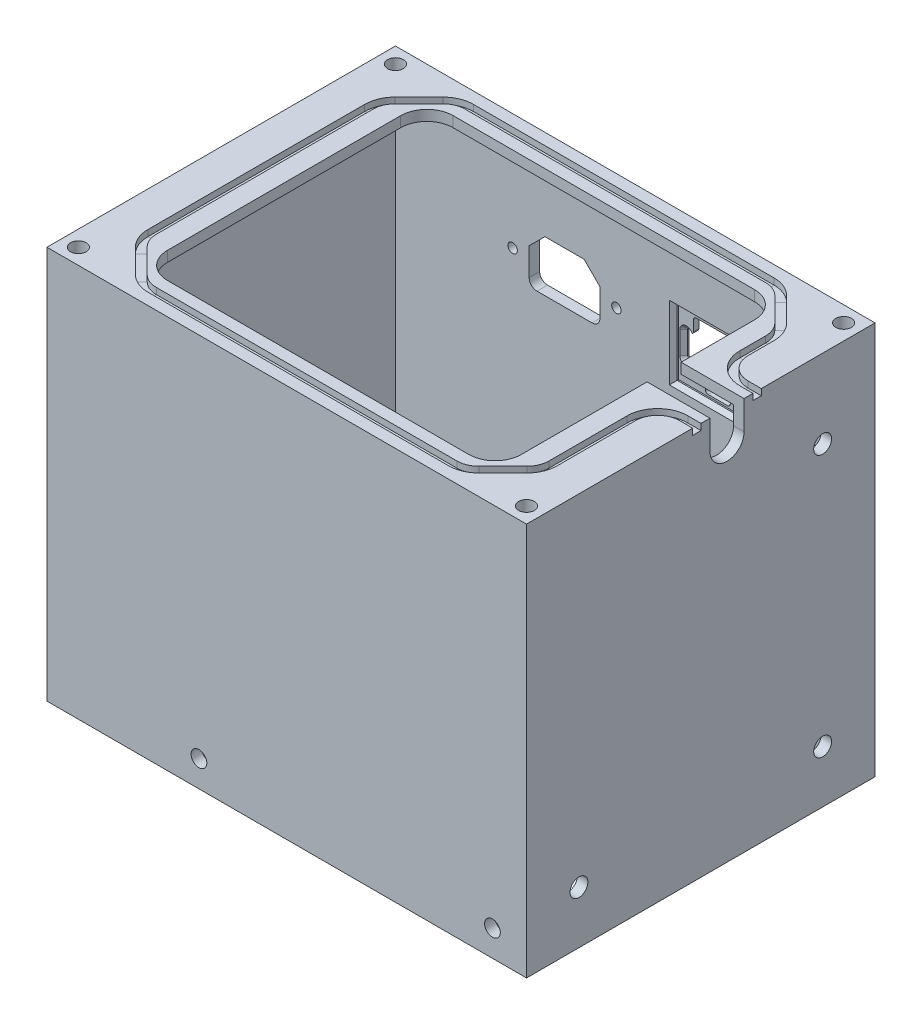
from build123d import *

# Parameters (mm, degrees)
SKETCH1_W           = 183
SKETCH1_H           = 133
SKETCH1_W_2         = 175
SKETCH1_H_2         = 125
BOSS_EXTRUDE1_DEPTH = 150
CUT_EXTRUDE1_REACH  = 219.975
SKETCH8_R           = 3
SKETCH9_R           = 3
CUT_EXTRUDE2_DEPTH  = 218.975342642
SKETCH11_R          = 1.8
CUT_EXTRUDE3_DEPTH  = 16.85
SKETCH12_W          = 175
SKETCH12_H          = 125
SKETCH12_W_2        = 135
SKETCH12_H_2        = 109
BOSS_EXTRUDE2_DEPTH = 4
BOSS_EXTRUDE3_DEPTH = 12
SKETCH15_R          = 3
CUT_EXTRUDE5_DEPTH  = 10
FILLET1_R           = 10
CUT_EXTRUDE6_REACH  = 247.787
SKETCH24_W          = 3.175
SKETCH24_H          = 2.38125
CUT_EXTRUDE7_REACH  = 247.787
SKETCH23_R          = 3.41
CUT_EXTRUDE8_REACH  = 222.366
SKETCH25_R          = 6.75
SKETCH25_R_2        = 3.41
SKETCH26_R          = 10
SKETCH26_R_2        = 6
CUT_EXTRUDE9_DEPTH  = 2
CHAMFER1_SIZE       = 2
CUT_EXTRUDE10_REACH = 222.366
SKETCH28_W          = 30
SKETCH28_H          = 25
CUT_EXTRUDE11_DEPTH = 2


with BuildPart() as part:
    # Sketch1 → Boss-Extrude1 (new body)
    with BuildSketch(Plane(origin=(0, 0, 0), x_dir=(1, 0, 0), z_dir=(0, 1, 0))):
        Rectangle(SKETCH1_W, SKETCH1_H)
        Rectangle(SKETCH1_W_2, SKETCH1_H_2, mode=Mode.SUBTRACT)
    extrude(amount=BOSS_EXTRUDE1_DEPTH)

    # Sketch8 → Cut-Extrude1 (cut, up to next)
    with BuildSketch(Plane.XY.offset(-62.5), mode=Mode.PRIVATE) as cut_extrude1_sk1:
        with Locations((-41.5, 10)):
            Circle(SKETCH8_R)
    cut_extrude1_tool1 = extrude(cut_extrude1_sk1.sketch, amount=-CUT_EXTRUDE1_REACH, mode=Mode.PRIVATE) & part.part
    # Sketch8 → Cut-Extrude1 (cut, up to next)
    with BuildSketch(Plane.XY.offset(-62.5), mode=Mode.PRIVATE) as cut_extrude1_sk2:
        with Locations((78.5, 10)):
            Circle(SKETCH8_R)
    cut_extrude1_tool2 = extrude(cut_extrude1_sk2.sketch, amount=-CUT_EXTRUDE1_REACH, mode=Mode.PRIVATE) & part.part
    add(cut_extrude1_tool1.solids().sort_by_distance((-41.5, 10, -62.5))[0], mode=Mode.SUBTRACT)
    add(cut_extrude1_tool2.solids().sort_by_distance((78.5, 10, -62.5))[0], mode=Mode.SUBTRACT)

    # Sketch9 → Cut-Extrude2 (cut, through all)
    with BuildSketch(Plane(origin=(0, 0, 62.5), x_dir=(-1, 0, 0), z_dir=(0, 0, -1))):
        with Locations((33.5, 10)):
            Circle(SKETCH9_R)
        with Locations(Location((-78.5, 10, 0), (0, 0, 180))):
            Circle(SKETCH9_R)
    extrude(amount=-CUT_EXTRUDE2_DEPTH, mode=Mode.SUBTRACT)

    # Sketch11 → Cut-Extrude3 (cut, symmetric)
    with BuildSketch(Plane(origin=(0, 0, -66.5), x_dir=(-1, 0, 0), z_dir=(0, 0, -1))):
        with Locations(Location((42.8, 109.6, 0), (0, 0, 180))):
            Circle(SKETCH11_R)
        with Locations(Location((3.2, 109.6, 0), (0, 0, 180))):
            Circle(SKETCH11_R)
        with BuildLine():
            Line((9.5, 103), (9.5, 113.48959236))
            Line((9.5, 113.48959236), (15.51040764, 119.5))
            Line((15.51040764, 119.5), (30.48959236, 119.5))
            Line((30.48959236, 119.5), (36.5, 113.48959236))
            Line((36.5, 113.48959236), (36.5, 103))
            ThreePointArc((36.5, 103), (35.621320344, 100.878679656), (33.5, 100))
            Line((33.5, 100), (12.5, 100))
            ThreePointArc((12.5, 100), (10.378679656, 100.878679656), (9.5, 103))
        make_face()
    extrude(amount=CUT_EXTRUDE3_DEPTH, both=True, mode=Mode.SUBTRACT)

    # Sketch12 → Boss-Extrude2 (add)
    with BuildSketch(Plane(origin=(0, 150, 0), x_dir=(1, 0, 0), z_dir=(0, 1, 0))):
        Rectangle(SKETCH12_W, SKETCH12_H)
        Rectangle(SKETCH12_W_2, SKETCH12_H_2, mode=Mode.SUBTRACT)
    extrude(amount=-BOSS_EXTRUDE2_DEPTH)

    # Sketch13 → Boss-Extrude3 (add)
    with BuildSketch(Plane(origin=(0, 150, 0), x_dir=(1, 0, 0), z_dir=(0, 1, 0))):
        with BuildLine():
            Line((76.5, -66.5), (91.5, -66.5))
            Line((91.5, -66.5), (91.5, -51.5))
            ThreePointArc((91.5, -51.5), (80.893398282, -55.893398282), (76.5, -66.5))
        make_face()
        with BuildLine():
            Line((91.5, 66.5), (91.5, 51.5))
            ThreePointArc((91.5, 51.5), (80.893398282, 55.893398282), (76.5, 66.5))
            Line((76.5, 66.5), (91.5, 66.5))
        make_face()
        with BuildLine():
            Line((-76.5, 66.5), (-91.5, 66.5))
            Line((-91.5, 66.5), (-91.5, 51.5))
            ThreePointArc((-91.5, 51.5), (-80.893398282, 55.893398282), (-76.5, 66.5))
        make_face()
        with BuildLine():
            Line((-91.5, -66.5), (-91.5, -51.5))
            ThreePointArc((-91.5, -51.5), (-80.893398282, -55.893398282), (-76.5, -66.5))
            Line((-76.5, -66.5), (-91.5, -66.5))
        make_face()
    extrude(amount=-BOSS_EXTRUDE3_DEPTH)

    # Sketch15 → Cut-Extrude5 (cut)
    with BuildSketch(Plane(origin=(0, 150, 0), x_dir=(1, 0, 0), z_dir=(0, 1, 0))):
        with Locations(Location((-85.5, -60.5, 0), (0, 0, 270))):
            Circle(SKETCH15_R)
        with Locations(Location((-85.5, 60.5, 0), (0, 0, 270))):
            Circle(SKETCH15_R)
        with Locations(Location((85.5, 60.5, 0), (0, 0, 90))):
            Circle(SKETCH15_R)
        with Locations(Location((85.5, -60.5, 0), (0, 0, 90))):
            Circle(SKETCH15_R)
    extrude(amount=-CUT_EXTRUDE5_DEPTH, mode=Mode.SUBTRACT)

    # Fillet1
    fillet1_edges = [part.edges().sort_by_distance(p)[0] for p in [
        (67.5, 148, -54.5),
        (67.5, 148, 54.5),
        (-67.5, 148, 54.5),
        (-67.5, 148, -54.5),
    ]]
    fillet(fillet1_edges, radius=FILLET1_R)

    # Sketch17 → Cut-Extrude6 (cut, up to next)
    with BuildSketch(Plane(origin=(91.5, 0, 0), x_dir=(0, 0, -1), z_dir=(1, 0, 0)), mode=Mode.PRIVATE) as cut_extrude6_sk1:
        with BuildLine():
            Line((16.5, 139), (16.5, 150))
            Line((16.5, 150), (3.5, 150))
            Line((3.5, 150), (3.5, 139))
            ThreePointArc((3.5, 139), (10, 132.5), (16.5, 139))
        make_face()
    cut_extrude6_tool1 = extrude(cut_extrude6_sk1.sketch, amount=-CUT_EXTRUDE6_REACH, mode=Mode.PRIVATE) & part.part
    add(cut_extrude6_tool1.solids().sort_by_distance((91.5, 141.882112, -10))[0], mode=Mode.SUBTRACT)

    # Cut-Sweep1: sweep along a path in Sketch16
    with BuildLine(Plane(origin=(0, 150, 0), x_dir=(1, 0, 0), z_dir=(0, 1, 0))) as cut_sweep1_path:
        Line((91.5, -1.5), (86.5, -1.5))
        ThreePointArc((86.5, -1.5), (79.428932188, -4.428932188), (76.5, -11.5))
        Line((76.5, -11.5), (76.5, -41.357864376))
        ThreePointArc((76.5, -41.357864376), (75.738795325, -45.1846987), (73.571067812, -48.428932188))
        Line((73.571067812, -48.428932188), (64.428932188, -57.571067812))
        ThreePointArc((64.428932188, -57.571067812), (61.1846987, -59.738795325), (57.357864376, -60.5))
        Line((57.357864376, -60.5), (-57.357864376, -60.5))
        ThreePointArc((-57.357864376, -60.5), (-61.1846987, -59.738795325), (-64.428932188, -57.571067812))
        Line((-64.428932188, -57.571067812), (-73.571067812, -48.428932188))
        ThreePointArc((-73.571067812, -48.428932188), (-75.738795325, -45.1846987), (-76.5, -41.357864376))
        Line((-76.5, -41.357864376), (-76.5, 41.357864376))
        ThreePointArc((-76.5, 41.357864376), (-75.738795325, 45.1846987), (-73.571067812, 48.428932188))
        Line((-73.571067812, 48.428932188), (-64.428932188, 57.571067812))
        ThreePointArc((-64.428932188, 57.571067812), (-61.1846987, 59.738795325), (-57.357864376, 60.5))
        Line((-57.357864376, 60.5), (57.357864376, 60.5))
        ThreePointArc((57.357864376, 60.5), (61.1846987, 59.738795325), (64.428932188, 57.571067812))
        Line((64.428932188, 57.571067812), (73.571067812, 48.428932188))
        ThreePointArc((73.571067812, 48.428932188), (75.738795325, 45.1846987), (76.5, 41.357864376))
        Line((76.5, 41.357864376), (76.5, 31.5))
        ThreePointArc((76.5, 31.5), (79.428932188, 24.428932188), (86.5, 21.5))
        Line((86.5, 21.5), (91.5, 21.5))
    # Sketch24 → Cut-Sweep1 (sweep, cut)
    with BuildSketch(Plane(origin=(0, 0, 0), x_dir=(0, 0, -1), z_dir=(1, 0, 0))):
        with Locations((60.5, 148.809375)):
            Rectangle(SKETCH24_W, SKETCH24_H)
    sweep(path=cut_sweep1_path.line, mode=Mode.SUBTRACT)

    # Sketch23 → Cut-Extrude7 (cut, up to next)
    with BuildSketch(Plane(origin=(91.5, 0, 0), x_dir=(0, 0, -1), z_dir=(1, 0, 0)), mode=Mode.PRIVATE) as cut_extrude7_sk1:
        with Locations((-46.5, 20)):
            Circle(SKETCH23_R)
    cut_extrude7_tool1 = extrude(cut_extrude7_sk1.sketch, amount=-CUT_EXTRUDE7_REACH, mode=Mode.PRIVATE) & part.part
    # Sketch23 → Cut-Extrude7 (cut, up to next)
    with BuildSketch(Plane(origin=(91.5, 0, 0), x_dir=(0, 0, -1), z_dir=(1, 0, 0)), mode=Mode.PRIVATE) as cut_extrude7_sk2:
        with Locations((46.5, 20)):
            Circle(SKETCH23_R)
    cut_extrude7_tool2 = extrude(cut_extrude7_sk2.sketch, amount=-CUT_EXTRUDE7_REACH, mode=Mode.PRIVATE) & part.part
    # Sketch23 → Cut-Extrude7 (cut, up to next)
    with BuildSketch(Plane(origin=(91.5, 0, 0), x_dir=(0, 0, -1), z_dir=(1, 0, 0)), mode=Mode.PRIVATE) as cut_extrude7_sk3:
        with Locations((46.5, 120)):
            Circle(SKETCH23_R)
    cut_extrude7_tool3 = extrude(cut_extrude7_sk3.sketch, amount=-CUT_EXTRUDE7_REACH, mode=Mode.PRIVATE) & part.part
    add(cut_extrude7_tool1.solids().sort_by_distance((91.5, 20, 46.5))[0], mode=Mode.SUBTRACT)
    add(cut_extrude7_tool2.solids().sort_by_distance((91.5, 20, -46.5))[0], mode=Mode.SUBTRACT)
    add(cut_extrude7_tool3.solids().sort_by_distance((91.5, 120, -46.5))[0], mode=Mode.SUBTRACT)

    # Sketch25 → Cut-Extrude8 (cut, up to next)
    with BuildSketch(Plane(origin=(0, 0, -66.5), x_dir=(-1, 0, 0), z_dir=(0, 0, -1)), mode=Mode.PRIVATE) as cut_extrude8_sk1:
        with Locations((-73.7, 45)):
            Circle(SKETCH25_R)
    cut_extrude8_tool1 = extrude(cut_extrude8_sk1.sketch, amount=-CUT_EXTRUDE8_REACH, mode=Mode.PRIVATE) & part.part
    # Sketch25 → Cut-Extrude8 (cut, up to next)
    with BuildSketch(Plane(origin=(0, 0, -66.5), x_dir=(-1, 0, 0), z_dir=(0, 0, -1)), mode=Mode.PRIVATE) as cut_extrude8_sk2:
        with Locations((-29.6, 42.2)):
            Circle(SKETCH25_R_2)
    cut_extrude8_tool2 = extrude(cut_extrude8_sk2.sketch, amount=-CUT_EXTRUDE8_REACH, mode=Mode.PRIVATE) & part.part
    # Sketch25 → Cut-Extrude8 (cut, up to next)
    with BuildSketch(Plane(origin=(0, 0, -66.5), x_dir=(-1, 0, 0), z_dir=(0, 0, -1)), mode=Mode.PRIVATE) as cut_extrude8_sk3:
        with Locations((-1.3, 42.2)):
            Circle(SKETCH25_R_2)
    cut_extrude8_tool3 = extrude(cut_extrude8_sk3.sketch, amount=-CUT_EXTRUDE8_REACH, mode=Mode.PRIVATE) & part.part
    add(cut_extrude8_tool1.solids().sort_by_distance((73.7, 45, -66.5))[0], mode=Mode.SUBTRACT)
    add(cut_extrude8_tool2.solids().sort_by_distance((29.6, 42.2, -66.5))[0], mode=Mode.SUBTRACT)
    add(cut_extrude8_tool3.solids().sort_by_distance((1.3, 42.2, -66.5))[0], mode=Mode.SUBTRACT)

    # Sketch26 → Cut-Extrude9 (cut)
    with BuildSketch(Plane(origin=(0, 0, -66.5), x_dir=(-1, 0, 0), z_dir=(0, 0, -1))):
        with Locations((-73.7, 45)):
            Circle(SKETCH26_R)
        with Locations((-29.6, 42.2)):
            Circle(SKETCH26_R_2)
        with Locations((-1.3, 42.2)):
            Circle(SKETCH26_R_2)
    extrude(amount=-CUT_EXTRUDE9_DEPTH, mode=Mode.SUBTRACT)

    # Chamfer1
    chamfer1_edges = [part.edges().sort_by_distance(p)[0] for p in [
        (83.7, 45, -66.5),
        (7.3, 42.2, -66.5),
        (35.6, 42.2, -66.5),
    ]]
    chamfer(chamfer1_edges, length=CHAMFER1_SIZE - 0.0001)  # a hair under: the kernel refuses the full size

    # Sketch27 → Cut-Extrude10 (cut, up to next)
    with BuildSketch(Plane(origin=(0, 0, -66.5), x_dir=(-1, 0, 0), z_dir=(0, 0, -1)), mode=Mode.PRIVATE) as cut_extrude10_sk1:
        with BuildLine():
            Line((-46.5, 104), (-46.5, 112.5))
            ThreePointArc((-46.5, 112.5), (-46.207106781, 113.207106781), (-45.5, 113.5))
            Line((-45.5, 113.5), (-43.75, 113.5))
            ThreePointArc((-43.75, 113.5), (-43.042893219, 113.792893219), (-42.75, 114.5))
            Line((-42.75, 114.5), (-42.75, 118.5))
            ThreePointArc((-42.75, 118.5), (-42.457106781, 119.207106781), (-41.75, 119.5))
            Line((-41.75, 119.5), (-25.25, 119.5))
            ThreePointArc((-25.25, 119.5), (-24.542893219, 119.207106781), (-24.25, 118.5))
            Line((-24.25, 118.5), (-24.25, 114.5))
            ThreePointArc((-24.25, 114.5), (-23.957106781, 113.792893219), (-23.25, 113.5))
            Line((-23.25, 113.5), (-21.5, 113.5))
            ThreePointArc((-21.5, 113.5), (-20.792893219, 113.207106781), (-20.5, 112.5))
            Line((-20.5, 112.5), (-20.5, 104))
            ThreePointArc((-20.5, 104), (-20.792893219, 103.292893219), (-21.5, 103))
            Line((-21.5, 103), (-27.75, 103))
            ThreePointArc((-27.75, 103), (-28.457106781, 102.707106781), (-28.75, 102))
            Line((-28.75, 102), (-28.75, 97.5))
            ThreePointArc((-28.75, 97.5), (-29.042893219, 96.792893219), (-29.75, 96.5))
            Line((-29.75, 96.5), (-37.25, 96.5))
            ThreePointArc((-37.25, 96.5), (-37.957106781, 96.792893219), (-38.25, 97.5))
            Line((-38.25, 97.5), (-38.25, 102))
            ThreePointArc((-38.25, 102), (-38.542893219, 102.707106781), (-39.25, 103))
            Line((-39.25, 103), (-45.5, 103))
            ThreePointArc((-45.5, 103), (-46.207106781, 103.292893219), (-46.5, 104))
        make_face()
    cut_extrude10_tool1 = extrude(cut_extrude10_sk1.sketch, amount=-CUT_EXTRUDE10_REACH, mode=Mode.PRIVATE) & part.part
    add(cut_extrude10_tool1.solids().sort_by_distance((33.5, 109.129067, -66.5))[0], mode=Mode.SUBTRACT)

    # Sketch28 → Cut-Extrude11 (cut)
    with BuildSketch(Plane.XY.offset(-62.5)):
        with Locations((33.5, 108.25)):
            Rectangle(SKETCH28_W, SKETCH28_H)
    extrude(amount=-CUT_EXTRUDE11_DEPTH, mode=Mode.SUBTRACT)

    # Chamfer2: read off the stored shape, not the designer's step
    # Chamfer2 outline → Chamfer2 (revolve, cut)
    with BuildSketch(Plane(origin=(45.5, 112.5, 0), x_dir=(1, 0, 0), z_dir=(0, -1, 0))):
        Polygon((0.999995373, -64.5), (0.999995373, -66.000004627), (2.5, -64.5), align=None)
    revolve(axis=Axis((45.5, 112.5, 0), (0, 0, 1)), mode=Mode.SUBTRACT)

    # Chamfer2 2 outline → Chamfer2 2 (revolve, cut)
    with BuildSketch(Plane(origin=(45.5, 104, 0), x_dir=(1, 0, 0), z_dir=(0, -1, 0))):
        Polygon((0.999988203, -64.5), (0.999988203, -66.000011797), (2.5, -64.5), align=None)
    revolve(axis=Axis((45.5, 104, 0), (0, 0, 1)), mode=Mode.SUBTRACT)

    # Chamfer2 3: loft between two sections, ruled curve by curve
    chamfer2_3_from = [
        Edge.make_line((48, 112.5, -64.5), (48, 104, -64.5)),
        Edge.make_line((48, 104, -64.5), (48, 112.5, -64.5)),
    ]
    chamfer2_3_to = [
        Edge.make_line((46.5, 112.5, -66), (46.5, 104, -66)),
        Edge.make_line((46.5, 104, -66), (46.5, 112.5, -66)),
    ]
    chamfer2_3 = Solid(Shell([*[Face.make_surface_from_curves(chamfer2_3_from[k], chamfer2_3_to[k]) for k in range(2)], Face(Wire(chamfer2_3_from)), Face(Wire(chamfer2_3_to))]))
    add(chamfer2_3, mode=Mode.SUBTRACT)

    # Chamfer2 4: loft between two sections, ruled curve by curve
    chamfer2_4_from = [
        Edge.make_line((48.5, 120.75, -64), (48.5, 95.75, -64)),
        Edge.make_line((18.5, 120.75, -64), (18.5, 95.75, -64)),
        Edge.make_line((48.5, 120.75, -64), (18.5, 120.75, -64)),
        Edge.make_line((18.5, 95.75, -64), (48.5, 95.75, -64)),
    ]
    chamfer2_4_to = [
        Edge.make_line((50, 122.25, -62.5), (50, 94.25, -62.5)),
        Edge.make_line((17, 122.25, -62.5), (17, 94.25, -62.5)),
        Edge.make_line((50, 122.25, -62.5), (17, 122.25, -62.5)),
        Edge.make_line((17, 94.25, -62.5), (50, 94.25, -62.5)),
    ]
    chamfer2_4 = Solid(Shell([*[Face.make_surface_from_curves(chamfer2_4_from[k], chamfer2_4_to[k]) for k in range(4)], Face(Wire(chamfer2_4_from)), Face(Wire(chamfer2_4_to))]))
    add(chamfer2_4, mode=Mode.SUBTRACT)

    # Chamfer2 5: loft between two sections, ruled curve by curve
    chamfer2_5_from = [
        Edge.make_three_point_arc((20.500006746, 104, -66.000006746), (21.295691735, 103.02110029, -66.000006746), (22.416508956, 103.600002698, -66.000006746)),
        Edge.make_three_point_arc((22.393294037, 112.949454144, -66.000008368), (21.26902738, 113.47295165, -66.000008368), (20.500008368, 112.5, -66.000008368)),
        Edge.make_line((20.500006746, 104, -66.000006746), (20.500008368, 112.5, -66.000008368)),
        Edge.make_line((22.393294037, 112.949454144, -66.000008368), (22.416508956, 103.600002698, -66.000006746)),
    ]
    chamfer2_5_to = [
        Edge.make_three_point_arc((19, 104, -64.5), (20.989225891, 101.552734218, -64.5), (23.791287847, 103, -64.5)),
        Edge.make_three_point_arc((23.73325378, 113.623644763, -64.5), (20.922563618, 114.932399479, -64.5), (19, 112.5, -64.5)),
        Edge.make_line((19, 104, -64.5), (19, 112.5, -64.5)),
        Edge.make_line((23.73325378, 113.623644763, -64.5), (23.791287847, 103, -64.5)),
    ]
    chamfer2_5 = Solid(Shell([*[Face.make_surface_from_curves(chamfer2_5_from[k], chamfer2_5_to[k]) for k in range(4)], Face(Wire(chamfer2_5_from)), Face(Wire(chamfer2_5_to))]))
    add(chamfer2_5, mode=Mode.SUBTRACT)


solid = part.part
